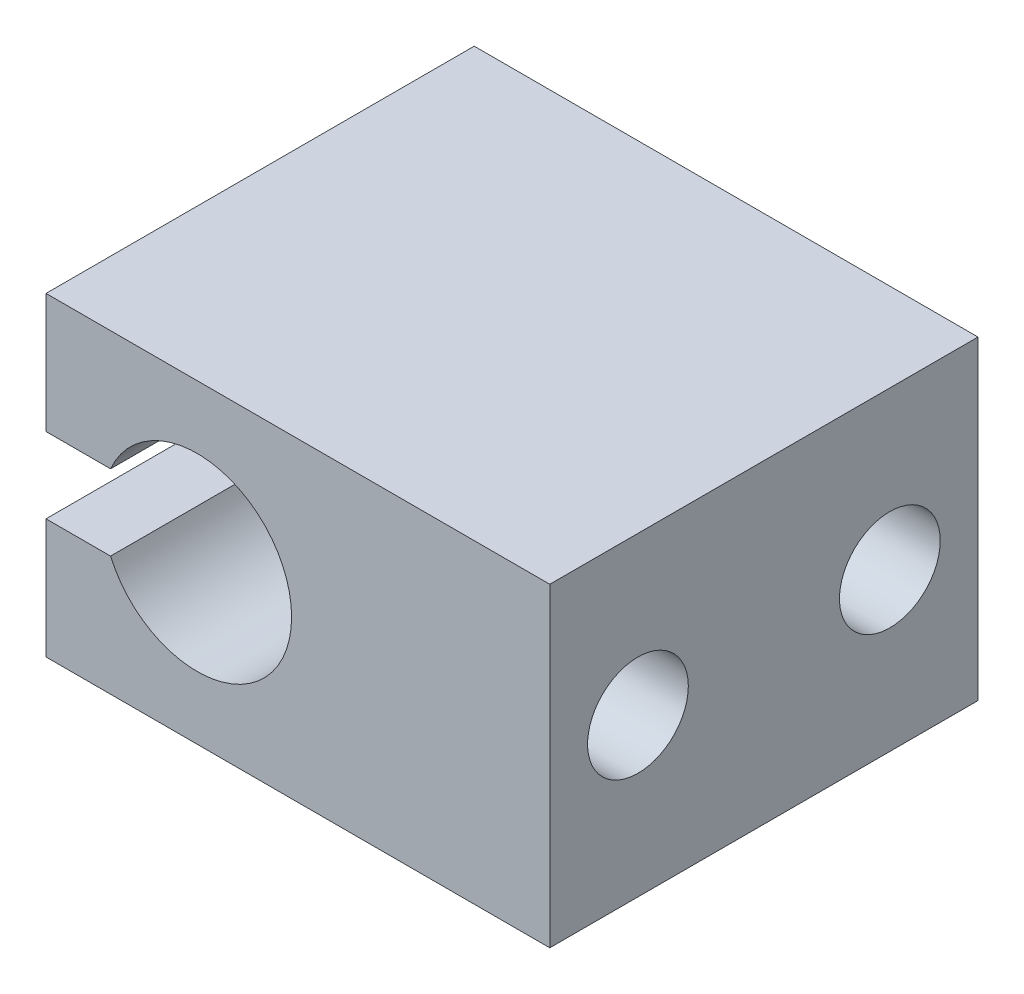
from build123d import *

# Parameters (mm, degrees)
BOSS_EXTRUDE1_DEPTH = 17
SKETCH2_R           = 4
CUT_EXTRUDE1_DEPTH  = 15


with BuildPart() as part:
    # Sketch1 → Boss-Extrude1 (new, symmetric)
    with BuildSketch(Plane.XY):
        with BuildLine():
            Line((-14.873863542, 3), (-20, 3))
            Line((-20, 3), (-20, 12.5))
            Line((-20, 12.5), (20, 12.5))
            Line((20, 12.5), (20, -12.5))
            Line((20, -12.5), (-20, -12.5))
            Line((-20, -12.5), (-20, -3))
            Line((-20, -3), (-14.873863542, -3))
            ThreePointArc((-14.873863542, -3), (-0.5, 0), (-14.873863542, 3))
        make_face()
    extrude(amount=BOSS_EXTRUDE1_DEPTH, both=True)

    # Sketch2 → Cut-Extrude1 (cut)
    with BuildSketch(Plane(origin=(20, 0, 0), x_dir=(0, 0, -1), z_dir=(1, 0, 0))):
        with Locations((-10, 0)):
            Circle(SKETCH2_R)
        with Locations((10, 0)):
            Circle(SKETCH2_R)
    extrude(amount=-CUT_EXTRUDE1_DEPTH, mode=Mode.SUBTRACT)


solid = part.part
